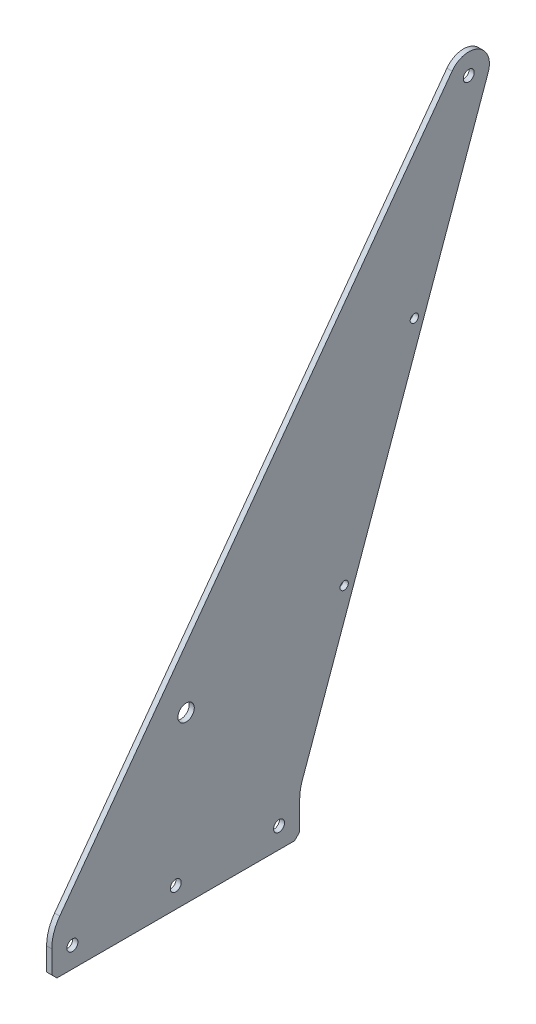
from build123d import *

# Parameters (mm, degrees)
SKETCH2_R           = 5.0419
SKETCH2_R_2         = 3.3782
BOSS_EXTRUDE2_DEPTH = 3.175
SKETCH3_R           = 3.3782
SKETCH3_R_2         = 2.54
CUT_EXTRUDE1_DEPTH  = 455.555955657
CHAMFER1_SIZE       = 3.175
FILLET1_R           = 25.4


with BuildPart() as part:
    # Sketch2 → Boss-Extrude2 (new body)
    with BuildSketch(Plane(origin=(0, 0, 0), x_dir=(0, 0, -1), z_dir=(1, 0, 0))):
        with BuildLine():
            Line((0, 0), (0, 25.4))
            Line((0, 25.4), (246.026003056, 361.228189786))
            ThreePointArc((246.026003056, 361.228189786), (262.223021081, 364.941655082), (268.229924144, 349.448097292))
            Line((268.229924144, 349.448097292), (152.4, 25.4))
            Line((152.4, 25.4), (152.4, 0))
            Line((152.4, 0), (0, 0))
        make_face()
        with Locations((82.55, 101.6)):
            Circle(SKETCH2_R, mode=Mode.SUBTRACT)
        with Locations((256.270953244, 353.722792017)):
            Circle(SKETCH2_R_2, mode=Mode.SUBTRACT)
    extrude(amount=BOSS_EXTRUDE2_DEPTH)

    # Sketch3 → Cut-Extrude1 (cut, through all)
    with BuildSketch(Plane(origin=(3.175, 0, 0), x_dir=(0, 0, -1), z_dir=(1, 0, 0))):
        with Locations((12.7, 12.7)):
            Circle(SKETCH3_R)
        with Locations((76.2, 12.7)):
            Circle(SKETCH3_R)
        with Locations((139.7, 12.7)):
            Circle(SKETCH3_R)
        with Locations((222.827415451, 241.294811505)):
            Circle(SKETCH3_R_2)
        with Locations((179.702397982, 120.647405753)):
            Circle(SKETCH3_R_2)
    extrude(amount=-CUT_EXTRUDE1_DEPTH, mode=Mode.SUBTRACT)

    # Chamfer1
    chamfer1_edges = [part.edges().sort_by_distance(p)[0] for p in [
        (1.5875, 0, 0),
        (1.5875, 0, -152.4),
    ]]
    chamfer(chamfer1_edges, length=CHAMFER1_SIZE)

    # Fillet1
    fillet1_edges = [part.edges().sort_by_distance(p)[0] for p in [
        (1.5875, 25.4, -152.4),
        (1.5875, 25.4, 0),
    ]]
    fillet(fillet1_edges, radius=FILLET1_R)


solid = part.part
